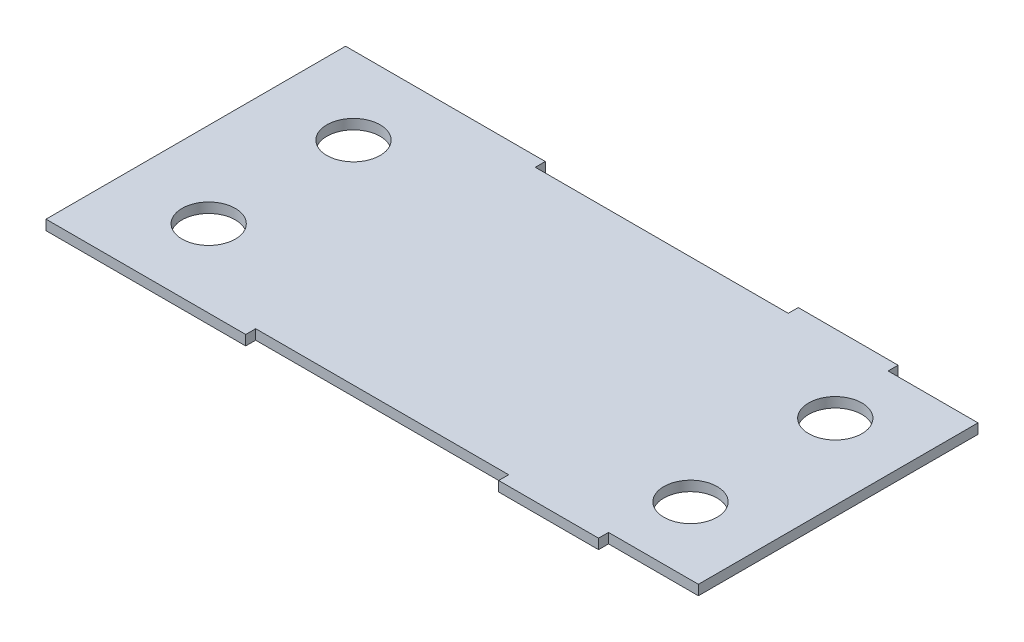
from build123d import *

# Parameters (mm, degrees)
SKETCH1_R           = 8
BOSS_EXTRUDE1_DEPTH = 3


with BuildPart() as part:
    # Sketch1 → Boss-Extrude1 (new body)
    with BuildSketch(Plane(origin=(0, 0, 0), x_dir=(1, 0, 0), z_dir=(0, 1, 0))):
        Polygon((68, 45), (38, 45), (38, 42), (-38, 42), (-38, 45), (-98, 45), (-98, -45), (-38, -45), (-38, -42), (38, -42), (38, -45), (68, -45), (68, -42), (95, -42), (95, 42), (68, 42), align=None)
        with Locations((-72.375, -21.75)):
            Circle(SKETCH1_R, mode=Mode.SUBTRACT)
        with Locations((72.375, -21.75)):
            Circle(SKETCH1_R, mode=Mode.SUBTRACT)
        with Locations((-72.375, 21.75)):
            Circle(SKETCH1_R, mode=Mode.SUBTRACT)
        with Locations((72.375, 21.75)):
            Circle(SKETCH1_R, mode=Mode.SUBTRACT)
    extrude(amount=BOSS_EXTRUDE1_DEPTH)


solid = part.part
